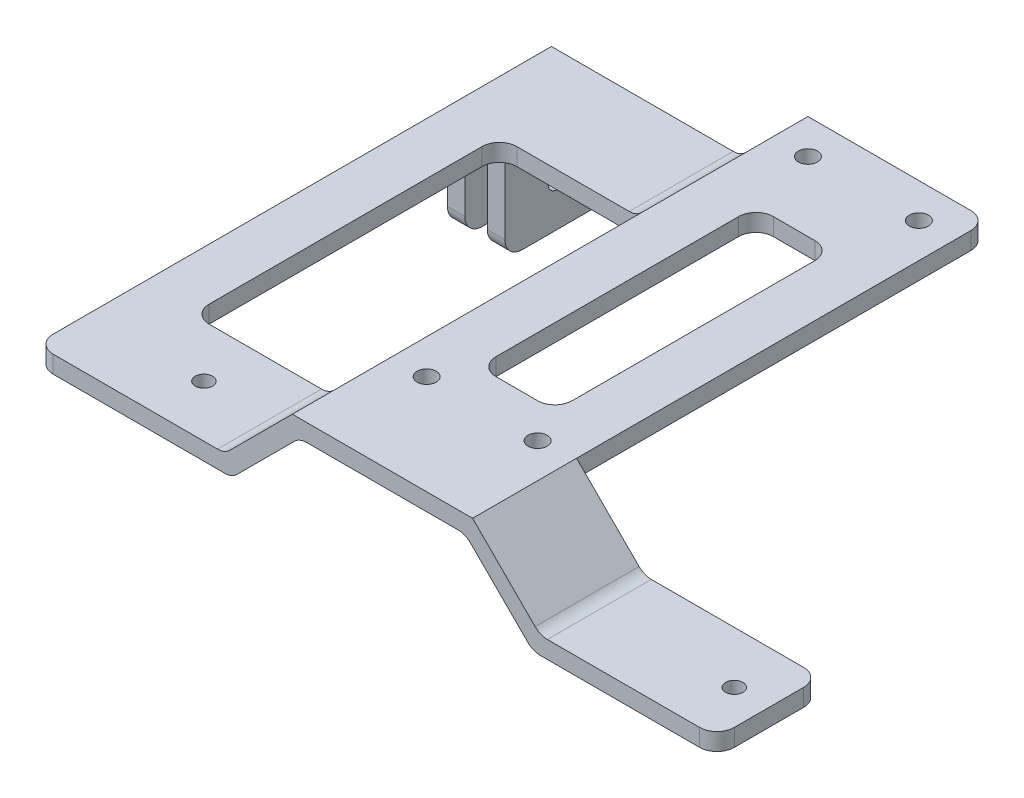
from build123d import *

# Parameters (mm, degrees)
SKETCH1_W           = 52
SKETCH1_H           = 148.75
SKETCH1_R           = 2.75
SKETCH1_W_2         = 22
SKETCH1_H_2         = 80
BOSS_EXTRUDE2_DEPTH = 5
BOSS_EXTRUDE3_DEPTH = 30
BOSS_EXTRUDE5_DEPTH = 30
SKETCH3_R           = 2.5
CUT_EXTRUDE1_DEPTH  = 5
CUT_EXTRUDE2_REACH  = 252.438
SKETCH5_R           = 2.5
SKETCH6_W           = 15
SKETCH6_H           = 88.75
BOSS_EXTRUDE6_DEPTH = 5
FILLET1_R           = 5
FILLET2_R           = 5


with BuildPart() as part:
    # Sketch1 → Boss-Extrude2 (new body)
    with BuildSketch(Plane(origin=(0, 0, 0), x_dir=(1, 0, 0), z_dir=(0, 1, 0))):
        with Locations((26, 74.375)):
            Rectangle(SKETCH1_W, SKETCH1_H)
        with Locations(Location((10, 28.75, 0), (0, 0, 270))):
            Circle(SKETCH1_R, mode=Mode.SUBTRACT)
        with Locations(Location((42, 28.75, 0), (0, 0, 270))):
            Circle(SKETCH1_R, mode=Mode.SUBTRACT)
        with Locations(Location((10, 138.75, 0), (0, 0, 270))):
            Circle(SKETCH1_R, mode=Mode.SUBTRACT)
        with Locations(Location((42, 138.75, 0), (0, 0, 270))):
            Circle(SKETCH1_R, mode=Mode.SUBTRACT)
        with Locations((26, 78.75)):
            Rectangle(SKETCH1_W_2, SKETCH1_H_2, mode=Mode.SUBTRACT)
    extrude(amount=BOSS_EXTRUDE2_DEPTH)

    # Sketch2 → Boss-Extrude3 (add)
    with BuildSketch(Plane.XY):
        Polygon((0, 5), (0, 0), (2.071067812, 0), (-17.428932188, -19.5), (-74, -19.5), (-74, -14.5), (-19.5, -14.5), align=None)
        Polygon((71.5, -14.5), (122.5, -14.5), (122.5, -19.5), (69.428932188, -19.5), (49.928932188, 0), (52, 0), (52, 5), align=None)
    extrude(amount=-BOSS_EXTRUDE3_DEPTH)

    # Sketch4 → Boss-Extrude5 (add)
    with BuildSketch(Plane(origin=(0, 0, -148.75), x_dir=(-1, 0, 0), z_dir=(0, 0, -1))):
        Polygon((74, -14.5), (74, -44.5), (69, -44.5), (69, -19.5), (62.5, -19.5), (62.5, -44.5), (57.428932188, -44.5), (57.428932188, -19.5), (17.428932188, -19.5), (-2.071067812, 0), (0, 0), (0, 5), (19.5, -14.5), align=None)
    extrude(amount=-BOSS_EXTRUDE5_DEPTH)

    # Sketch3 → Cut-Extrude1 (cut)
    with BuildSketch(Plane(origin=(0, -14.5, 0), x_dir=(1, 0, 0), z_dir=(0, 1, 0))):
        with Locations(Location((-40.5, 15, 0), (0, 0, 180))):
            Circle(SKETCH3_R)
        with Locations(Location((112.5, 15, 0), (0, 0, 180))):
            Circle(SKETCH3_R)
    extrude(amount=-CUT_EXTRUDE1_DEPTH, mode=Mode.SUBTRACT)

    # Cut-Extrude2: up to this face of the body (flat: up to its plane)
    cut_extrude2_end = Plane(part.part.faces().sort_by_distance((-57.428932188, -32, -133.75))[0])
    # Sketch5 → Cut-Extrude2 (cut, up to the picked face)
    with BuildSketch(Plane.ZY.offset(74), mode=Mode.PRIVATE) as cut_extrude2_sk1:
        with Locations((-133.75, -32)):
            Circle(SKETCH5_R)
    cut_extrude2_tool1 = split(extrude(cut_extrude2_sk1.sketch, amount=-CUT_EXTRUDE2_REACH, mode=Mode.PRIVATE), bisect_by=cut_extrude2_end, keep=Keep.BOTH, mode=Mode.PRIVATE)
    add(cut_extrude2_tool1.solids().sort_by(Axis((-74, -32, -133.75), (1, 0, 0)))[0], mode=Mode.SUBTRACT)

    # Sketch6 → Boss-Extrude6 (add)
    with BuildSketch(Plane(origin=(0, -14.5, 0), x_dir=(1, 0, 0), z_dir=(0, 1, 0))):
        with Locations((-66.5, 74.375)):
            Rectangle(SKETCH6_W, SKETCH6_H)
    extrude(amount=-BOSS_EXTRUDE6_DEPTH)

    # Fillet1
    # the kernel refuses this fillet: 5 mm, written as the material it adds along each edge
    with BuildSketch(Plane(origin=(-59, -14.5, -118.75), x_dir=(0, 0, 1), z_dir=(0, -1, 0)), Plane(origin=(-59, -14.5, -30), x_dir=(1, 0, 0), z_dir=(0, -1, 0)), Plane(origin=(15, 0, -118.75), x_dir=(1, 0, 0), z_dir=(0, 1, 0))) as fillet1_piece_1:
        with BuildLine():
            CenterArc((FILLET1_R, -FILLET1_R), FILLET1_R, 90, 90)
            Line((0, -FILLET1_R), (0, 0))
            Line((0, 0), (FILLET1_R, 0))
        make_face()
    extrude(amount=5)
    with BuildSketch(Plane(origin=(15, 0, -38.75), x_dir=(1, 0, 0), z_dir=(0, 1, 0)), Plane(origin=(37, 0, -38.75), x_dir=(0, 0, -1), z_dir=(0, 1, 0)), Plane(origin=(37, 0, -118.75), x_dir=(-1, 0, 0), z_dir=(0, 1, 0))) as fillet1_piece_2:
        with BuildLine():
            CenterArc((FILLET1_R, FILLET1_R), FILLET1_R, 180, 90)
            Line((0, FILLET1_R), (0, 0))
            Line((0, 0), (FILLET1_R, 0))
        make_face()
    extrude(amount=5)
    # the kernel refuses this fillet: 5 mm, written as the material it takes off along each edge
    with BuildSketch(Plane(origin=(-74, -32, 0), x_dir=(1, 0, 0), z_dir=(0, 1, 0)), Plane(origin=(122.5, -2, 0), x_dir=(-1, 0, 0), z_dir=(0, -1, 0)), Plane(origin=(52, -12.5, -148.75), x_dir=(-1, 0, 0), z_dir=(0, 1, 0)), Plane(origin=(-86.5, -44.5, -148.75), x_dir=(0, 1, 0), z_dir=(1, 0, 0))) as fillet1_2_piece_1:
        with BuildLine():
            CenterArc((FILLET1_R, FILLET1_R), FILLET1_R, 180, 90)
            Line((0, FILLET1_R), (0, 0))
            Line((0, 0), (FILLET1_R, 0))
        make_face()
    extrude(amount=30, mode=Mode.SUBTRACT)
    with BuildSketch(Plane(origin=(122.5, -2, -30), x_dir=(-1, 0, 0), z_dir=(0, -1, 0)), Plane(origin=(-86.5, -44.5, -118.75), x_dir=(0, 1, 0), z_dir=(1, 0, 0))) as fillet1_2_piece_2:
        with BuildLine():
            CenterArc((FILLET1_R, -FILLET1_R), FILLET1_R, 90, 90)
            Line((0, -FILLET1_R), (0, 0))
            Line((0, 0), (FILLET1_R, 0))
        make_face()
    extrude(amount=30, mode=Mode.SUBTRACT)
    with BuildSketch(Plane(origin=(-75, -44.5, -118.75), x_dir=(0, 1, 0), z_dir=(1, 0, 0))) as fillet1_2_piece_3:
        with BuildLine():
            CenterArc((FILLET1_R, -FILLET1_R), FILLET1_R, 90, 90)
            Line((0, -FILLET1_R), (0, 0))
            Line((0, 0), (FILLET1_R, 0))
        make_face()
    extrude(amount=30.071067812, mode=Mode.SUBTRACT)
    with BuildSketch(Plane(origin=(-75, -44.5, -148.75), x_dir=(0, 1, 0), z_dir=(1, 0, 0))) as fillet1_2_piece_4:
        with BuildLine():
            CenterArc((FILLET1_R, FILLET1_R), FILLET1_R, 180, 90)
            Line((0, FILLET1_R), (0, 0))
            Line((0, 0), (FILLET1_R, 0))
        make_face()
    extrude(amount=30.071067812, mode=Mode.SUBTRACT)

    # Fillet2
    fillet2_edges = [part.edges().sort_by_distance(p)[0] for p in [
        (-19.5, -14.5, -15),
        (2.071067812, 0, -15),
        (-17.428932188, -19.5, -15),
        (49.928932188, 0, -15),
        (71.5, -14.5, -15),
        (69.428932188, -19.5, -15),
        (-19.5, -14.5, -133.75),
        (-17.428932188, -19.5, -133.75),
        (2.071067812, 0, -133.75),
    ]]
    fillet(fillet2_edges, radius=FILLET2_R)


solid = part.part
